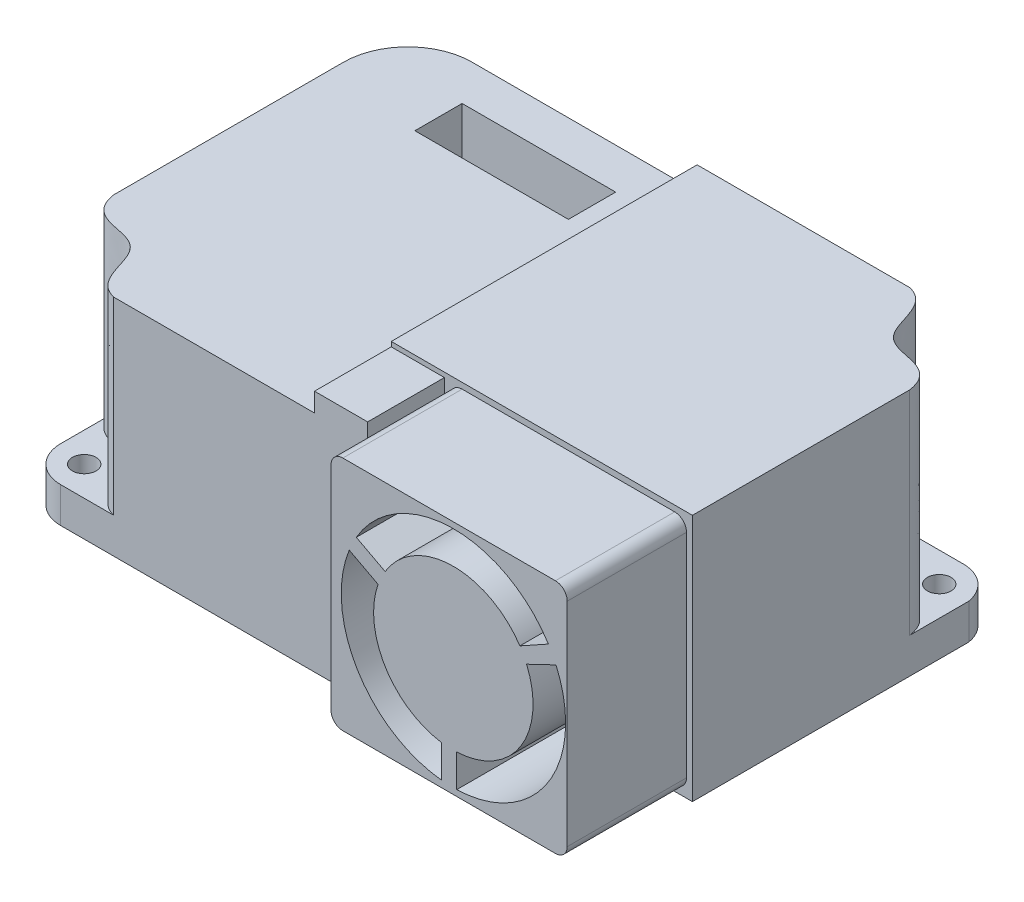
from build123d import *

# Parameters (mm, degrees)
SKETCH1_R           = 1
BOSS_EXTRUDE1_DEPTH = 3
BOSS_EXTRUDE2_DEPTH = 16
BOSS_EXTRUDE3_DEPTH = 2
SKETCH4_W           = 4.5
SKETCH4_H           = 6.5
BOSS_EXTRUDE4_DEPTH = 1.6
BOSS_EXTRUDE5_DEPTH = 10.1
CUT_EXTRUDE1_DEPTH  = 10.1
SKETCH8_W           = 13
SKETCH8_H           = 4
CUT_EXTRUDE2_DEPTH  = 5
SKETCH9_W           = 10
SKETCH9_H           = 5
CUT_EXTRUDE3_DEPTH  = 5


# Read off the part's stored shape, not the designer's step: Boss-Extrude2
with BuildPart() as part:
    # Sketch1 → Boss-Extrude1 (new body)
    with BuildSketch(Plane(origin=(0, 0, 0), x_dir=(1, 0, 0), z_dir=(0, 1, 0))):
        with BuildLine():
            Line((4.5, -16.7), (4.5, -10.2))
            Line((4.5, -10.2), (25.5, -10.2))
            Line((25.5, -10.2), (25.5, 13.2))
            ThreePointArc((25.5, 13.2), (24.478451782, 14.991287847), (22.541960108, 15.7))
            Line((22.541960108, 15.7), (-19.05, 15.7))
            ThreePointArc((-19.05, 15.7), (-22.903731957, 14.103731957), (-24.5, 10.25))
            Line((-24.5, 10.25), (-24.5, -13.7))
            ThreePointArc((-24.5, -13.7), (-23.621320344, -15.821320344), (-21.5, -16.7))
            Line((-21.5, -16.7), (4.5, -16.7))
        make_face()
        with Locations(Location((23, 13.2, 0), (0, 0, 270))):
            Circle(SKETCH1_R, mode=Mode.SUBTRACT)
        with Locations(Location((-22, -14.2, 0), (0, 0, 270))):
            Circle(SKETCH1_R, mode=Mode.SUBTRACT)
    extrude(amount=BOSS_EXTRUDE1_DEPTH)

    # Boss-Extrude2 outline → Boss-Extrude2 (add)
    with BuildSketch(Plane(origin=(0, 3, 0), x_dir=(1, 0, 0), z_dir=(0, 1, 0))):
        with BuildLine():
            Line((-24.5, 10.25), (-24.5, -9.2))
            add(Edge.make_bspline(
                [(-24.5, -9.2), (-23.769282577, -14.160806345), (-16.834317029, -8.300272079), (-21.009947693, -15.748034375), (-17, -16.7)],
                knots=[0, 0, 0, 0, 0, 1, 1, 1, 1, 1], degree=4))
            Line((-17, -16.7), (4.5, -16.7))
            Line((4.5, -16.7), (4.5, -10.2))
            Line((4.5, -10.2), (25.5, -10.2))
            Line((25.5, -10.2), (25.5, 8.2))
            add(Edge.make_bspline(
                [(25.5, 8.2), (24.79086606, 13.172227374), (17.855900512, 7.311693108), (22.031531177, 14.759455405), (18, 15.7)],
                knots=[0, 0, 0, 0, 0, 1, 1, 1, 1, 1], degree=4))
            Line((18, 15.7), (-19.05, 15.7))
            ThreePointArc((-19.05, 15.7), (-22.903731957, 14.103731957), (-24.5, 10.25))
        make_face()
    extrude(amount=BOSS_EXTRUDE2_DEPTH)

    # Sketch3 → Boss-Extrude3 (add)
    with BuildSketch(Plane(origin=(0, 19, 0), x_dir=(1, 0, 0), z_dir=(0, 1, 0))):
        with BuildLine():
            Line((25.5, -10.2), (25.5, 8.2))
            add(Edge.make_bspline(
                [(25.5, 8.2), (24.79086606, 13.172227374), (17.855900512, 7.311693108), (22.031531177, 14.759455405), (18, 15.7)],
                knots=[0, 0, 0, 0, 0, 1, 1, 1, 1, 1], degree=4))
            Line((18, 15.7), (0, 15.7))
            Line((0, 15.7), (0, -10.2))
            Line((0, -10.2), (25.5, -10.2))
        make_face()
    extrude(amount=BOSS_EXTRUDE3_DEPTH)

    # Sketch4 → Boss-Extrude4 (add)
    with BuildSketch(Plane(origin=(0, 19, 0), x_dir=(1, 0, 0), z_dir=(0, 1, 0))):
        with Locations((2.25, -13.45)):
            Rectangle(SKETCH4_W, SKETCH4_H)
    extrude(amount=BOSS_EXTRUDE4_DEPTH)

    # Sketch5 → Boss-Extrude5 (add)
    with BuildSketch(Plane.XY.offset(10.2)):
        with BuildLine():
            Line((6, 0.5), (24, 0.5))
            ThreePointArc((24, 0.5), (24.707106781, 0.792893219), (25, 1.5))
            Line((25, 1.5), (25, 19.5))
            ThreePointArc((25, 19.5), (24.707106781, 20.207106781), (24, 20.5))
            Line((24, 20.5), (6, 20.5))
            ThreePointArc((6, 20.5), (5.292893219, 20.207106781), (5, 19.5))
            Line((5, 19.5), (5, 1.5))
            ThreePointArc((5, 1.5), (5.292893219, 0.792893219), (6, 0.5))
        make_face()
    extrude(amount=BOSS_EXTRUDE5_DEPTH)

    # Sketch7 → Cut-Extrude1 (cut)
    with BuildSketch(Plane.XY.offset(20.3)):
        with BuildLine():
            Line((14.357886119, 1.053511456), (14.357886119, 3.813652456))
            ThreePointArc((14.357886119, 3.813652456), (9.574356132, 7.008298347), (8.98130736, 12.729855361))
            Line((8.98130736, 12.729855361), (6.540165326, 14.017955408))
            ThreePointArc((6.540165326, 14.017955408), (7.229438492, 5.594282327), (14.357886119, 1.053511456))
        make_face()
        with BuildLine():
            Line((7.140555489, 15.255205238), (9.581697527, 13.967105189))
            ThreePointArc((9.581697527, 13.967105189), (15.216789935, 17.241147229), (20.990144219, 14.217573506))
            Line((20.990144219, 14.217573506), (23.405000511, 15.560138833))
            ThreePointArc((23.405000511, 15.560138833), (15.186710134, 19.998330789), (7.140555489, 15.255205238))
        make_face()
        with BuildLine():
            Line((24.047997852, 14.353815082), (21.559268085, 13.160247955))
            ThreePointArc((21.559268085, 13.160247955), (21.07012739, 6.908676596), (15.644806916, 3.764268729))
            Line((15.644806916, 3.764268729), (15.644806916, 1.004127729))
            ThreePointArc((15.644806916, 1.004127729), (23.404589952, 5.439208876), (24.047997852, 14.353815082))
        make_face()
    extrude(amount=-CUT_EXTRUDE1_DEPTH, mode=Mode.SUBTRACT)

    # Sketch8 → Cut-Extrude2 (cut)
    with BuildSketch(Plane(origin=(0, 19, 0), x_dir=(1, 0, 0), z_dir=(0, 1, 0))):
        with Locations((-9.95, 10.25)):
            Rectangle(SKETCH8_W, SKETCH8_H)
    extrude(amount=-CUT_EXTRUDE2_DEPTH, mode=Mode.SUBTRACT)

    # Sketch9 → Cut-Extrude3 (cut)
    with BuildSketch(Plane(origin=(0, 0, -15.7), x_dir=(-1, 0, 0), z_dir=(0, 0, -1))):
        with Locations((-8.95, 16.35)):
            Rectangle(SKETCH9_W, SKETCH9_H)
    extrude(amount=-CUT_EXTRUDE3_DEPTH, mode=Mode.SUBTRACT)


solid = part.part
